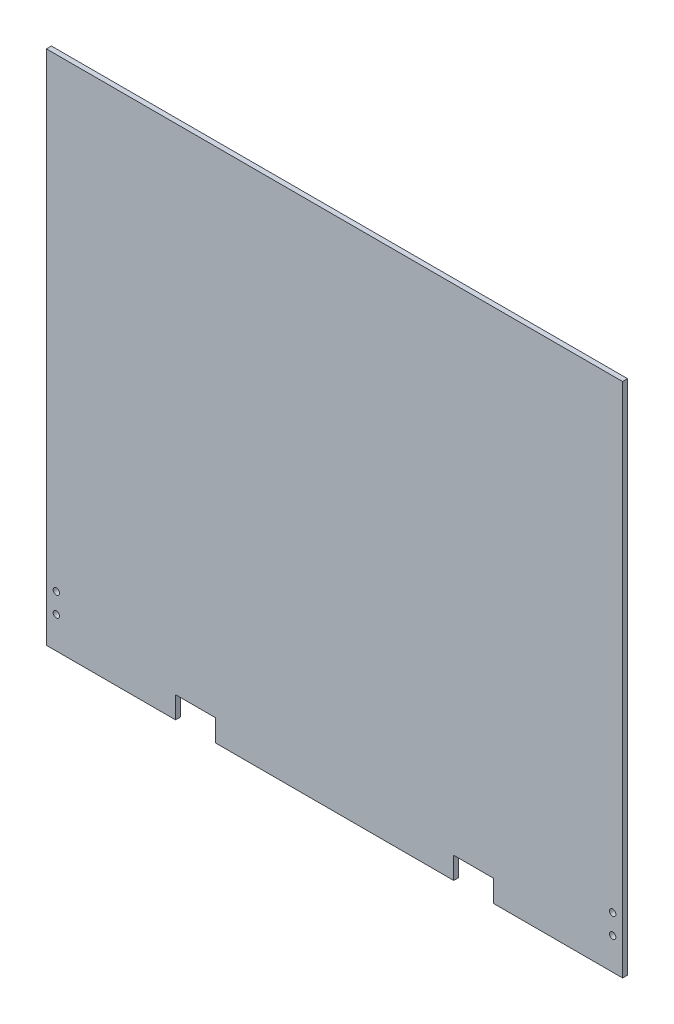
from build123d import *

# Parameters (mm, degrees)
SKETCH1_R           = 2.032
BOSS_EXTRUDE1_DEPTH = 3.175


with BuildPart() as part:
    # Sketch1 → Boss-Extrude1 (new body)
    with BuildSketch(Plane.XY):
        Polygon((82.55, 0), (82.55, 13.97), (107.95, 13.97), (107.95, 0), (260.35, 0), (260.35, 13.97), (285.75, 13.97), (285.75, 0), (368.3, 0), (368.3, 330.2), (0, 330.2), (0, 0), align=None)
        with Locations((6.35, 20.32)):
            Circle(SKETCH1_R, mode=Mode.SUBTRACT)
        with Locations((6.35, 33.02)):
            Circle(SKETCH1_R, mode=Mode.SUBTRACT)
        with Locations((361.95, 20.32)):
            Circle(SKETCH1_R, mode=Mode.SUBTRACT)
        with Locations((361.95, 33.02)):
            Circle(SKETCH1_R, mode=Mode.SUBTRACT)
    extrude(amount=BOSS_EXTRUDE1_DEPTH)


solid = part.part
